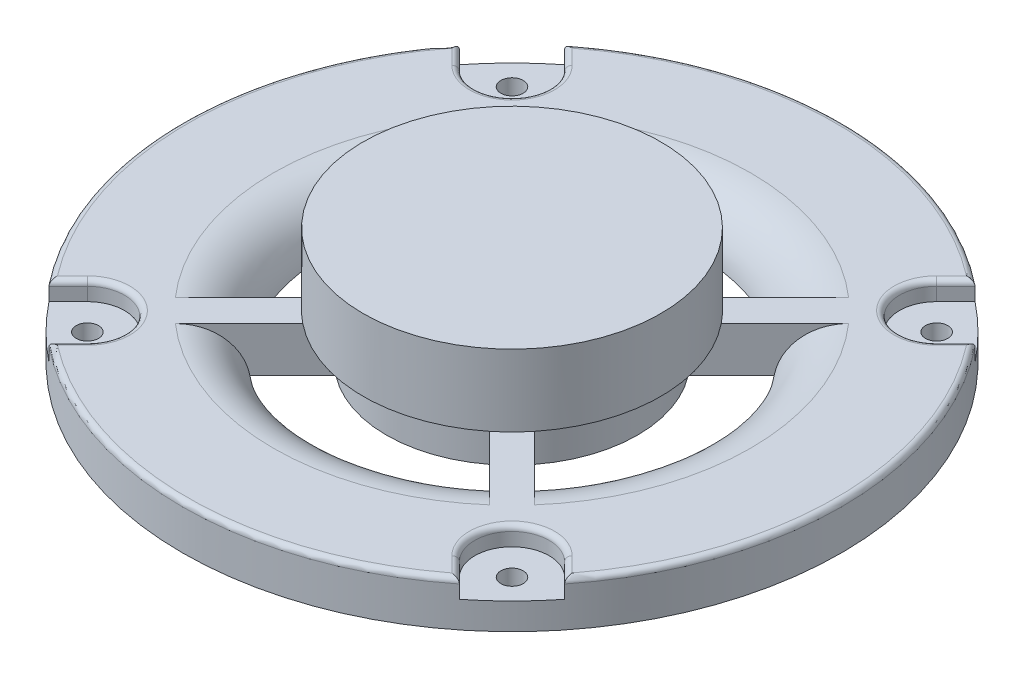
from build123d import *

# Parameters (mm, degrees)
SKETCH_1_R            = 62
SKETCH_1_R_2          = 35
EXTRUDE_1_DEPTH       = 8.5
FILLET_1_R            = 10
EXTRUDE_2_DEPTH       = 8.5
SKETCH_3_R            = 28
EXTRUDE_3_DEPTH       = 13.5
CUT_EXTRUDE_START     = -3.5
CUT_EXTRUDE_1_DEPTH   = 3.5
FILLET_2_R            = 1
HOLE_WIZARD_M51_D     = 4.2
HOLE_WIZARD_M51_DEPTH = 14
HOLE_WIZARD_M51_TIP   = 1.2618073


with BuildPart() as part:
    # Эскиз1 → Бобышка-Вытянуть1 (new body)
    with BuildSketch(Plane(origin=(0, 0, 0), x_dir=(1, 0, 0), z_dir=(0, 1, 0))):
        with Locations(Location((0, 0, 0), (0, 0, 270))):
            Circle(SKETCH_1_R)
        with Locations(Location((0, 0, 0), (0, 0, 270))):
            Circle(SKETCH_1_R_2, mode=Mode.SUBTRACT)
    extrude(amount=EXTRUDE_1_DEPTH)

    # Скругление1
    # the kernel refuses this fillet: 10 mm, written as the material it takes off along each edge
    with BuildSketch(Plane(origin=(0, 8.5, 0), x_dir=(0, 0, 1), z_dir=(-1, 0, 0))) as fillet_1_piece_1:
        with BuildLine():
            CenterArc((44.886859967, -10), FILLET_1_R, 90, 81.373073441)
            Line((44.886859967, 0), (44.886859967, 0.2))
            Line((44.886859967, 0.2), (35, 0.2))
            Line((35, 0.2), (34.8, 0))
            ThreePointArc((34.8, 0), (34.8, -4.25), (34.802262801, -8.47))
            Line((34.802262801, -8.47), (35, -8.5))
        make_face()
    revolve(axis=Axis((0, 8.5, 0), (0, 1, 0)), mode=Mode.SUBTRACT)

    # Эскиз2 → Бобышка-Вытянуть2 (add)
    with BuildSketch(Plane(origin=(0, 8.5, 0), x_dir=(1, 0, 0), z_dir=(0, 1, 0))):
        with BuildLine():
            Line((-14.448842978, 18.691483665), (-29.547514476, 33.790155163))
            ThreePointArc((-29.547514476, 33.790155163), (-31.739803069, 31.739803069), (-33.790155163, 29.547514476))
            Line((-33.790155163, 29.547514476), (-18.691483665, 14.448842978))
            ThreePointArc((-18.691483665, 14.448842978), (-23.625, 0), (-18.691483665, -14.448842978))
            Line((-18.691483665, -14.448842978), (-33.790155163, -29.547514476))
            ThreePointArc((-33.790155163, -29.547514476), (-31.739803069, -31.739803069), (-29.547514476, -33.790155163))
            Line((-29.547514476, -33.790155163), (-14.448842978, -18.691483665))
            ThreePointArc((-14.448842978, -18.691483665), (0, -23.625), (14.448842978, -18.691483665))
            Line((14.448842978, -18.691483665), (29.547514476, -33.790155163))
            ThreePointArc((29.547514476, -33.790155163), (31.739803069, -31.739803069), (33.790155163, -29.547514476))
            Line((33.790155163, -29.547514476), (18.691483665, -14.448842978))
            ThreePointArc((18.691483665, -14.448842978), (23.625, 0), (18.691483665, 14.448842978))
            Line((18.691483665, 14.448842978), (33.790155163, 29.547514476))
            ThreePointArc((33.790155163, 29.547514476), (31.739803069, 31.739803069), (29.547514476, 33.790155163))
            Line((29.547514476, 33.790155163), (14.448842978, 18.691483665))
            ThreePointArc((14.448842978, 18.691483665), (0, 23.625), (-14.448842978, 18.691483665))
        make_face()
    extrude(amount=-EXTRUDE_2_DEPTH)

    # Эскиз3 → Бобышка-Вытянуть3 (add)
    with BuildSketch(Plane(origin=(0, 8.5, 0), x_dir=(1, 0, 0), z_dir=(0, 1, 0))):
        with Locations(Location((0, 0, 0), (0, 0, 51.150639828))):
            Circle(SKETCH_3_R)
    extrude(amount=EXTRUDE_3_DEPTH)

    # Эскиз4 → Вырез-Вытянуть1 (cut)
    with BuildSketch(Plane(origin=(0, 8.5, 0), x_dir=(1, 0, 0), z_dir=(0, 1, 0)).offset(CUT_EXTRUDE_START)):
        with BuildLine():
            Line((-48.510050498, -38.610555561), (-44.901280605, -35.001785669))
            ThreePointArc((-44.901280605, -35.001785669), (-35.001785669, -35.001785669), (-35.001785669, -44.901280605))
            Line((-35.001785669, -44.901280605), (-38.610555561, -48.510050498))
            ThreePointArc((-38.610555561, -48.510050498), (-43.840620434, -43.840620434), (-48.510050498, -38.610555561))
        make_face()
        with BuildLine():
            Line((38.610555561, -48.510050498), (35.001785669, -44.901280605))
            ThreePointArc((35.001785669, -44.901280605), (35.001785669, -35.001785669), (44.901280605, -35.001785669))
            Line((44.901280605, -35.001785669), (48.510050498, -38.610555561))
            ThreePointArc((48.510050498, -38.610555561), (43.840620434, -43.840620434), (38.610555561, -48.510050498))
        make_face()
        with BuildLine():
            Line((48.510050498, 38.610555561), (44.901280605, 35.001785669))
            ThreePointArc((44.901280605, 35.001785669), (35.001785669, 35.001785669), (35.001785669, 44.901280605))
            Line((35.001785669, 44.901280605), (38.610555561, 48.510050498))
            ThreePointArc((38.610555561, 48.510050498), (43.840620434, 43.840620434), (48.510050498, 38.610555561))
        make_face()
        with BuildLine():
            Line((-38.610555561, 48.510050498), (-35.001785669, 44.901280605))
            ThreePointArc((-35.001785669, 44.901280605), (-35.001785669, 35.001785669), (-44.901280605, 35.001785669))
            Line((-44.901280605, 35.001785669), (-48.510050498, 38.610555561))
            ThreePointArc((-48.510050498, 38.610555561), (-43.840620434, 43.840620434), (-38.610555561, 48.510050498))
        make_face()
    extrude(amount=CUT_EXTRUDE_1_DEPTH, mode=Mode.SUBTRACT)

    # Скругление2
    fillet_2_edges = [part.edges().sort_by_distance(p)[0] for p in [
        (62, 8.5, 0),
        (0, 8.5, -62),
        (-62, 8.5, 0),
        (-20.449656099, 8.5, 58.530432814),
        (-46.705665551, 8.5, -36.806170615),
        (-35.001785669, 8.5, -35.001785669),
        (-36.806170615, 8.5, -46.705665551),
        (36.806170615, 8.5, -46.705665551),
        (35.001785669, 8.5, -35.001785669),
        (46.705665551, 8.5, -36.806170615),
        (46.705665551, 8.5, 36.806170615),
        (35.001785669, 8.5, 35.001785669),
        (36.806170615, 8.5, 46.705665551),
        (-36.806170615, 8.5, 46.705665551),
        (-35.001785669, 8.5, 35.001785669),
        (-46.705665551, 8.5, 36.806170615),
    ]]
    fillet(fillet_2_edges, radius=FILLET_2_R)

    # Отверстие обработанное метчиком M51
    with Locations(Plane(origin=(0, 5, 0), x_dir=(1, 0, 0), z_dir=(0, 1, 0))):
        with Locations((39.951533137, -39.951533137), (39.951533137, 39.951533137), (-39.951533137, -39.951533137), (-39.951533137, 39.951533137)):
            Hole(HOLE_WIZARD_M51_D / 2, depth=HOLE_WIZARD_M51_DEPTH)
            with Locations((0, 0, -(HOLE_WIZARD_M51_DEPTH + HOLE_WIZARD_M51_TIP / 2))):  # 118° drill point
                Cone(0, HOLE_WIZARD_M51_D / 2, HOLE_WIZARD_M51_TIP, mode=Mode.SUBTRACT)


solid = part.part
